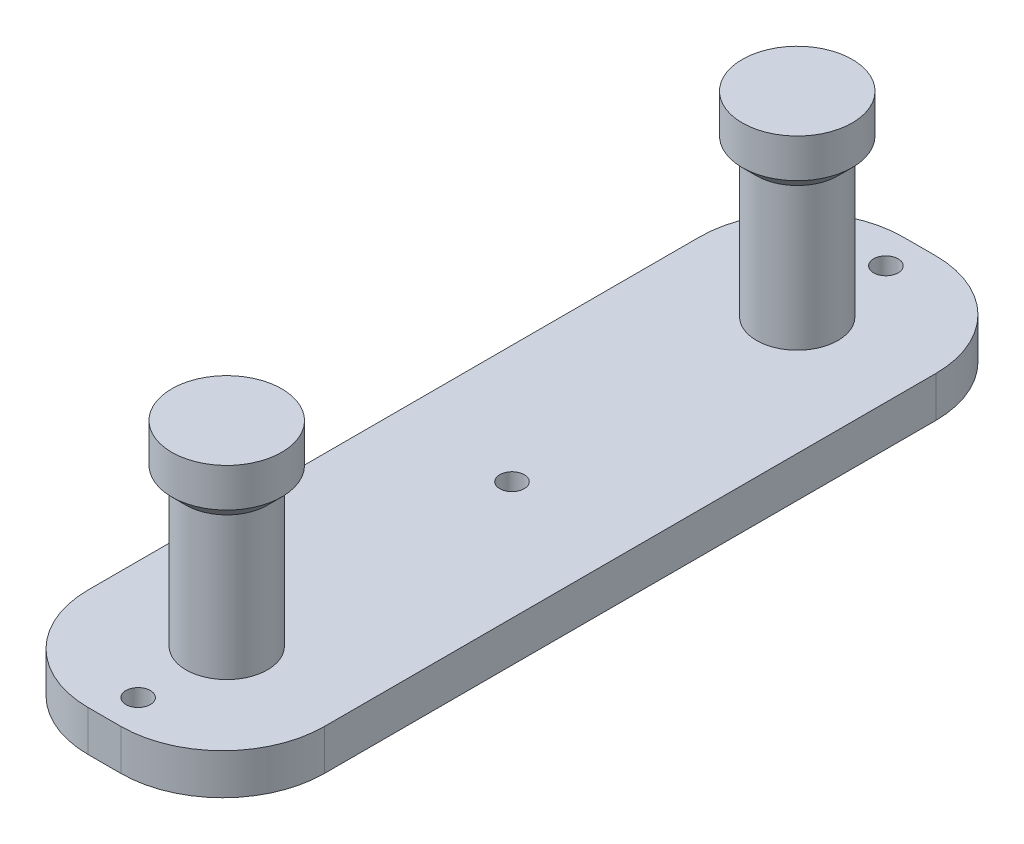
from build123d import *

# Parameters (mm, degrees)
BOSS_EXTRUDE1_DEPTH = 10
BOSS_EXTRUDE2_DEPTH = 50
SKETCH3_R           = 13.5
BOSS_EXTRUDE3_DEPTH = 8
CHAMFER2_SIZE       = 5
FILLET1_R           = 25
CUT_EXTRUDE1_DEPTH  = 10


with BuildPart() as part:
    # Sketch1 → Boss-Extrude1 (new body)
    with BuildSketch(Plane(origin=(0, 0, 0), x_dir=(1, 0, 0), z_dir=(0, 1, 0))):
        with BuildLine():
            Line((30.30044843, 30.235426009), (1.30044843, 30.235426009))
            Line((1.30044843, 30.235426009), (1.30044843, 10.235426009))
            ThreePointArc((1.30044843, 10.235426009), (8.371516242, 7.306493821), (11.30044843, 0.235426009))
            ThreePointArc((11.30044843, 0.235426009), (8.371516242, -6.835641803), (1.30044843, -9.764573991))
            Line((1.30044843, -9.764573991), (1.30044843, -129.764573991))
            ThreePointArc((1.30044843, -129.764573991), (8.371516242, -132.693506179), (11.30044843, -139.764573991))
            ThreePointArc((11.30044843, -139.764573991), (8.371516242, -146.835641803), (1.30044843, -149.764573991))
            Line((1.30044843, -149.764573991), (1.30044843, -169.764573991))
            Line((1.30044843, -169.764573991), (30.30044843, -169.764573991))
            Line((30.30044843, -169.764573991), (30.30044843, 30.235426009))
        make_face()
        with BuildLine():
            Line((1.30044843, 10.235426009), (1.30044843, 30.235426009))
            Line((1.30044843, 30.235426009), (-27.69955157, 30.235426009))
            Line((-27.69955157, 30.235426009), (-27.69955157, -169.764573991))
            Line((-27.69955157, -169.764573991), (1.30044843, -169.764573991))
            Line((1.30044843, -169.764573991), (1.30044843, -149.764573991))
            ThreePointArc((1.30044843, -149.764573991), (-8.69955157, -139.764573991), (1.30044843, -129.764573991))
            Line((1.30044843, -129.764573991), (1.30044843, -9.764573991))
            ThreePointArc((1.30044843, -9.764573991), (-8.69955157, 0.235426009), (1.30044843, 10.235426009))
        make_face()
        with BuildLine():
            ThreePointArc((11.30044843, 0.235426009), (8.371516242, 7.306493821), (1.30044843, 10.235426009))
            Line((1.30044843, 10.235426009), (1.30044843, -9.764573991))
            ThreePointArc((1.30044843, -9.764573991), (8.371516242, -6.835641803), (11.30044843, 0.235426009))
        make_face()
        with BuildLine():
            Line((1.30044843, -9.764573991), (1.30044843, 10.235426009))
            ThreePointArc((1.30044843, 10.235426009), (-8.69955157, 0.235426009), (1.30044843, -9.764573991))
        make_face()
        with BuildLine():
            ThreePointArc((11.30044843, -139.764573991), (8.371516242, -132.693506179), (1.30044843, -129.764573991))
            Line((1.30044843, -129.764573991), (1.30044843, -149.764573991))
            ThreePointArc((1.30044843, -149.764573991), (8.371516242, -146.835641803), (11.30044843, -139.764573991))
        make_face()
        with BuildLine():
            Line((1.30044843, -149.764573991), (1.30044843, -129.764573991))
            ThreePointArc((1.30044843, -129.764573991), (-8.69955157, -139.764573991), (1.30044843, -149.764573991))
        make_face()
    extrude(amount=BOSS_EXTRUDE1_DEPTH)

    # Sketch1<3> → Boss-Extrude2 (add)
    with BuildSketch(Plane(origin=(0, 0, 0), x_dir=(1, 0, 0), z_dir=(0, 1, 0))):
        with BuildLine():
            ThreePointArc((11.30044843, 0.235426009), (8.371516242, 7.306493821), (1.30044843, 10.235426009))
            Line((1.30044843, 10.235426009), (1.30044843, -9.764573991))
            ThreePointArc((1.30044843, -9.764573991), (8.371516242, -6.835641803), (11.30044843, 0.235426009))
        make_face()
        with BuildLine():
            Line((1.30044843, -9.764573991), (1.30044843, 10.235426009))
            ThreePointArc((1.30044843, 10.235426009), (-8.69955157, 0.235426009), (1.30044843, -9.764573991))
        make_face()
        with BuildLine():
            ThreePointArc((11.30044843, -139.764573991), (8.371516242, -132.693506179), (1.30044843, -129.764573991))
            Line((1.30044843, -129.764573991), (1.30044843, -149.764573991))
            ThreePointArc((1.30044843, -149.764573991), (8.371516242, -146.835641803), (11.30044843, -139.764573991))
        make_face()
        with BuildLine():
            Line((1.30044843, -149.764573991), (1.30044843, -129.764573991))
            ThreePointArc((1.30044843, -129.764573991), (-8.69955157, -139.764573991), (1.30044843, -149.764573991))
        make_face()
    extrude(amount=BOSS_EXTRUDE2_DEPTH)

    # Sketch3 → Boss-Extrude3 (add)
    with BuildSketch(Plane(origin=(0, 50, 0), x_dir=(1, 0, 0), z_dir=(0, 1, 0))):
        with Locations(Location((1.30044843, -139.764573991, 0), (0, 0, 270))):
            Circle(SKETCH3_R)
        with Locations(Location((1.30044843, 0.235426009, 0), (0, 0, 270))):
            Circle(SKETCH3_R)
    extrude(amount=BOSS_EXTRUDE3_DEPTH)

    # Chamfer2
    # the kernel refuses this chamfer: 5 mm, written as the material it adds along each edge
    with BuildSketch(Plane(origin=(1.30044843, 50, -0.235426009), x_dir=(0, 0, -1), z_dir=(-1, 0, 0))) as chamfer2_piece_1_section:
        Polygon((10, CHAMFER2_SIZE), (10 + CHAMFER2_SIZE, 0), (10, 0), align=None)
    chamfer2_piece_1 = revolve(axis=Axis((1.30044843, 50, -0.235426009), (0, -1, 0)), mode=Mode.PRIVATE)
    chamfer2_piece_1 = chamfer2_piece_1 & Plane(origin=(1.30044843, 46.747090697, -0.235426009), x_dir=(0, 0, 1), z_dir=(0, -1, 0)) * Cylinder(13.5, 61, mode=Mode.PRIVATE)
    add(chamfer2_piece_1)
    with BuildSketch(Plane(origin=(1.30044843, 50, 139.764573991), x_dir=(0, 0, -1), z_dir=(-1, 0, 0))) as chamfer2_piece_2_section:
        Polygon((10 + CHAMFER2_SIZE, 0), (10, CHAMFER2_SIZE), (10, 0), align=None)
    chamfer2_piece_2 = revolve(axis=Axis((1.30044843, 50, 139.764573991), (0, -1, 0)), mode=Mode.PRIVATE)
    chamfer2_piece_2 = chamfer2_piece_2 & Plane(origin=(1.30044843, 46.747090697, 139.764573991), x_dir=(0, 0, 1), z_dir=(0, -1, 0)) * Cylinder(13.5, 60, mode=Mode.PRIVATE)
    add(chamfer2_piece_2)

    # Fillet1
    fillet1_edges = [part.edges().sort_by_distance(p)[0] for p in [
        (-27.69955157, 5, -30.235426009),
        (30.30044843, 5, -30.235426009),
        (30.30044843, 5, 169.764573991),
        (-27.69955157, 5, 169.764573991),
    ]]
    fillet(fillet1_edges, radius=FILLET1_R)

    # Sketch4 → Cut-Extrude1 (cut)
    with BuildSketch(Plane(origin=(0, 10, 0), x_dir=(1, 0, 0), z_dir=(0, 1, 0))):
        with BuildLine():
            ThreePointArc((4.30044843, 21.985426009), (3.421768774, 24.106746353), (1.30044843, 24.985426009))
            Line((1.30044843, 24.985426009), (1.30044843, 18.985426009))
            ThreePointArc((1.30044843, 18.985426009), (3.421768774, 19.864105665), (4.30044843, 21.985426009))
        make_face()
        with BuildLine():
            Line((1.30044843, 18.985426009), (1.30044843, 24.985426009))
            ThreePointArc((1.30044843, 24.985426009), (-1.69955157, 21.985426009), (1.30044843, 18.985426009))
        make_face()
        with BuildLine():
            ThreePointArc((4.30044843, -69.764573991), (3.421768774, -67.643253647), (1.30044843, -66.764573991))
            Line((1.30044843, -66.764573991), (1.30044843, -72.764573991))
            ThreePointArc((1.30044843, -72.764573991), (3.421768774, -71.885894335), (4.30044843, -69.764573991))
        make_face()
        with BuildLine():
            Line((1.30044843, -72.764573991), (1.30044843, -66.764573991))
            ThreePointArc((1.30044843, -66.764573991), (-1.69955157, -69.764573991), (1.30044843, -72.764573991))
        make_face()
        with BuildLine():
            ThreePointArc((4.30044843, -161.514573991), (3.421768774, -159.393253647), (1.30044843, -158.514573991))
            Line((1.30044843, -158.514573991), (1.30044843, -164.514573991))
            ThreePointArc((1.30044843, -164.514573991), (3.421768774, -163.635894335), (4.30044843, -161.514573991))
        make_face()
        with BuildLine():
            Line((1.30044843, -164.514573991), (1.30044843, -158.514573991))
            ThreePointArc((1.30044843, -158.514573991), (-1.69955157, -161.514573991), (1.30044843, -164.514573991))
        make_face()
    extrude(amount=-CUT_EXTRUDE1_DEPTH, mode=Mode.SUBTRACT)


solid = part.part
